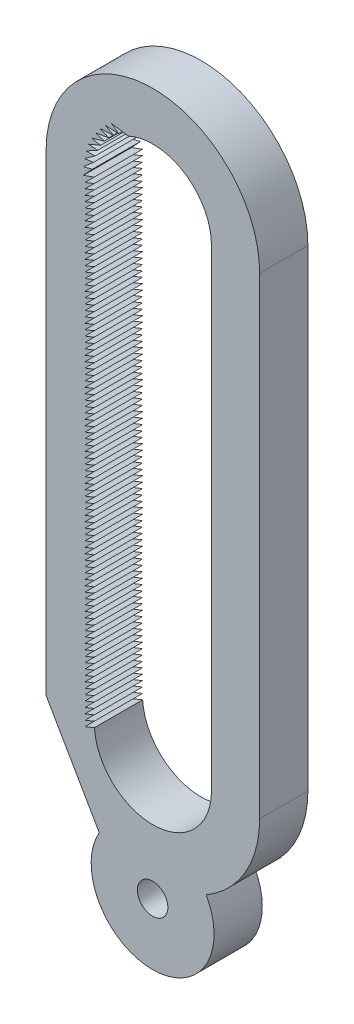
from build123d import *

# Parameters (mm, degrees)
ESTRUSIONE_SOTTILE1_DEPTH    = 10
TAGLIO_ESTRUSIONE2_DEPTH     = 10
SCHIZZO3_R                   = 12.75
SCHIZZO3_R_2                 = 3.161562041
ESTRUSIONE_ESTRUSIONE1_DEPTH = 10
TAGLIO_ESTRUSIONE3_DEPTH     = 91.520539246
RIPETIZIONECIRCOLARE1_COUNT  = 10
RIPETIZIONECIRCOLARE1_ANGLE  = 56
TAGLIO_ESTRUSIONE4_DEPTH     = 91.520539246
RIPETIZIONE_A_L1_COUNT       = 86
RIPETIZIONE_A_L1_PITCH       = 1.15


with BuildPart() as part:
    # Schizzo1 → Estrusione-Sottile1 (new body)
    with BuildSketch(Plane.XY):
        with BuildLine():
            Line((22.150088511, 48.999474912), (22.150088511, -48.999474912))
            ThreePointArc((22.150088511, -48.999474912), (0, -71.149563424), (-22.150088511, -48.999474912))
            Line((-22.150088511, -48.999474912), (-22.150088511, 48.999474912))
            ThreePointArc((-22.150088511, 48.999474912), (0, 71.149563424), (22.150088511, 48.999474912))
        make_face()
        with BuildLine():
            Line((12.150088511, 48.999474912), (12.150088511, -48.999474912))
            ThreePointArc((12.150088511, -48.999474912), (0, -61.149563424), (-12.150088511, -48.999474912))
            Line((-12.150088511, -48.999474912), (-12.150088511, 48.999474912))
            ThreePointArc((-12.150088511, 48.999474912), (0, 61.149563424), (12.150088511, 48.999474912))
        make_face(mode=Mode.SUBTRACT)
    extrude(amount=ESTRUSIONE_SOTTILE1_DEPTH)

    # Schizzo2 → Taglio-Estrusione2 (cut)
    with BuildSketch(Plane.XY.offset(10)):
        Polygon((-22.150088511, -48.999474912), (-11.112747904, -68.160196587), (-24.875817955, -68.160196587), (-24.875817955, -48.999474912), align=None)
    extrude(amount=-TAGLIO_ESTRUSIONE2_DEPTH, mode=Mode.SUBTRACT)

    # Schizzo3 → Estrusione-Estrusione1 (add)
    with BuildSketch(Plane.XY.offset(10)):
        with Locations((-0.05861952, -74.447142179)):
            Circle(SCHIZZO3_R)
        with Locations((-0.05861952, -74.447142179)):
            Circle(SCHIZZO3_R_2, mode=Mode.SUBTRACT)
    extrude(amount=-ESTRUSIONE_ESTRUSIONE1_DEPTH)

    # Schizzo4 → Taglio-Estrusione3 (cut, through all)
    with BuildSketch(Plane.XY.offset(10)):
        Polygon((-3.483846187, 59.790869285), (-8.635292625, 60.570675397), (-3.889589832, 57.110502177), align=None)
    taglio_estrusione3 = extrude(amount=-TAGLIO_ESTRUSIONE3_DEPTH, mode=Mode.SUBTRACT)

    # RipetizioneCircolare1: Taglio-Estrusione3 ×10 about axis
    ripetizionecircolare1_axis = Axis((0, 48.999474912, 10), (0, 0, 1))
    for i in range(1, RIPETIZIONECIRCOLARE1_COUNT):
        add(taglio_estrusione3.rotate(ripetizionecircolare1_axis, i * RIPETIZIONECIRCOLARE1_ANGLE / (RIPETIZIONECIRCOLARE1_COUNT - 1)), mode=Mode.SUBTRACT)

    # Schizzo5 → Taglio-Estrusione4 (cut, through all)
    with BuildSketch(Plane.XY.offset(10)):
        Polygon((-12.149346124, 49.133786454), (-14.086818705, 47.196313874), (-11.842617554, 48.10183096), align=None)
    taglio_estrusione4 = extrude(amount=-TAGLIO_ESTRUSIONE4_DEPTH, mode=Mode.SUBTRACT)

    # Ripetizione a L1: Taglio-Estrusione4 ×86
    with Locations(*[(0, -i * RIPETIZIONE_A_L1_PITCH, 0) for i in range(1, RIPETIZIONE_A_L1_COUNT)]):
        add(taglio_estrusione4, mode=Mode.SUBTRACT)


solid = part.part
